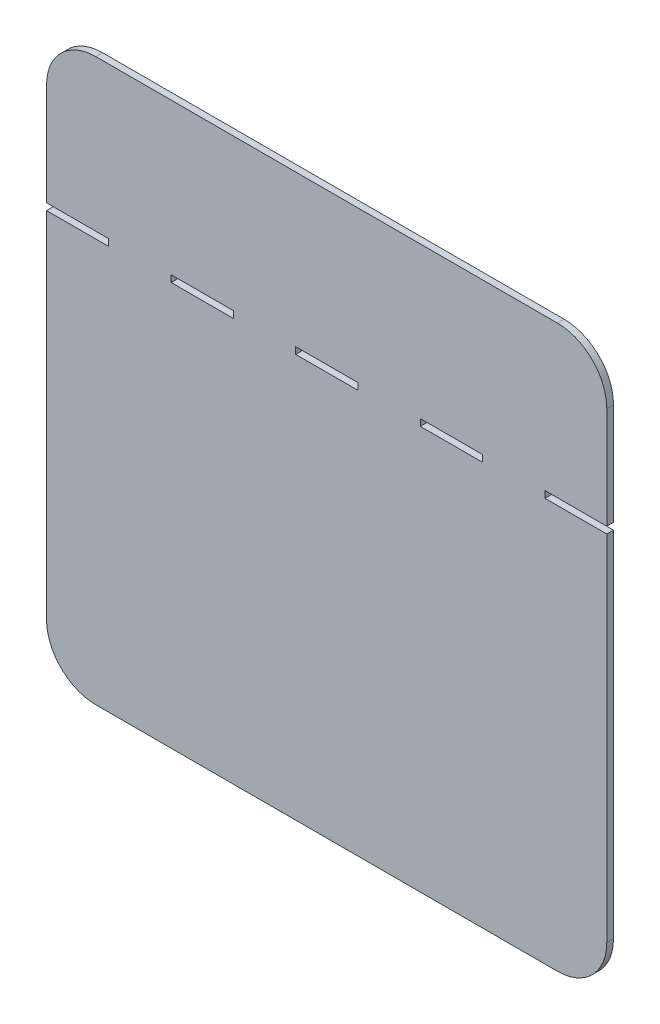
from build123d import *

# Parameters (mm, degrees)
SKETCH1_W           = 500
SKETCH1_H           = 501
BOSS_EXTRUDE1_DEPTH = 6
FILLET1_R           = 44
SKETCH2_W           = 55.5
SKETCH2_H           = 6
CUT_EXTRUDE1_DEPTH  = 10
LPATTERN1_COUNT     = 5
LPATTERN1_PITCH     = 111.2


with BuildPart() as part:
    # Sketch1 → Boss-Extrude1 (new body)
    with BuildSketch(Plane.XY):
        with Locations((250, 250.5)):
            Rectangle(SKETCH1_W, SKETCH1_H)
    extrude(amount=BOSS_EXTRUDE1_DEPTH)

    # Fillet1
    fillet1_edges = [part.edges().sort_by_distance(p)[0] for p in [
        (0, 0, 3),
        (0, 501, 3),
        (500, 0, 3),
        (500, 501, 3),
    ]]
    fillet(fillet1_edges, radius=FILLET1_R)

    # Sketch2 → Cut-Extrude1 (cut)
    with BuildSketch(Plane(origin=(0, 0, 0), x_dir=(-1, 0, 0), z_dir=(0, 0, -1))):
        with Locations((-27.75, 363)):
            Rectangle(SKETCH2_W, SKETCH2_H)
    cut_extrude1 = extrude(amount=-CUT_EXTRUDE1_DEPTH, mode=Mode.SUBTRACT)

    # LPattern1: Cut-Extrude1 ×5
    with Locations(*[(i * LPATTERN1_PITCH, 0, 0) for i in range(1, LPATTERN1_COUNT)]):
        add(cut_extrude1, mode=Mode.SUBTRACT)


solid = part.part
